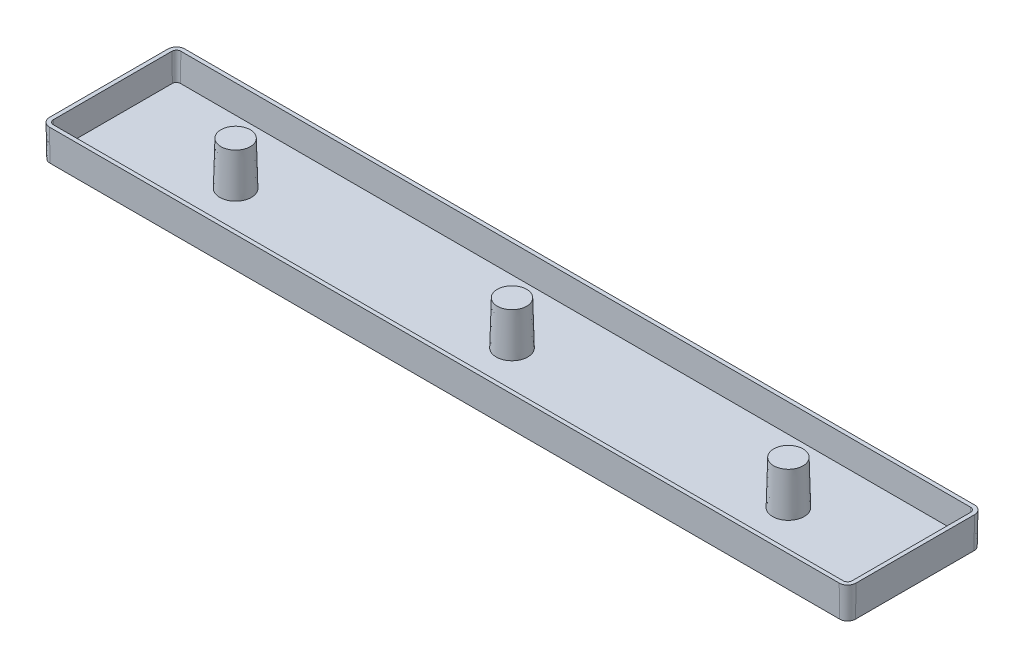
from build123d import *

# Parameters (mm, degrees)
BOSS_EXTRUDE1_DEPTH           = 4
BOSS_EXTRUDE1_DRAFT           = -1
SHELL1_T                      = -0.5
SKETCH2_R                     = 2
BOSS_EXTRUDE2_DEPTH           = 5.5
BOSS_EXTRUDE2_DRAFT           = 1.5
BOSS_EXTRUDE2_PROFILE_2_DEPTH = 5.5
BOSS_EXTRUDE2_PROFILE_2_DRAFT = 1.5
BOSS_EXTRUDE2_PROFILE_3_DEPTH = 5.5
BOSS_EXTRUDE2_PROFILE_3_DRAFT = 1.5


with BuildPart() as part:
    # Sketch1 → Boss-Extrude1 (with draft: the straight prism first)
    with BuildSketch(Plane(origin=(0, 0, 0), x_dir=(1, 0, 0), z_dir=(0, 1, 0))):
        with BuildLine():
            Line((-50, -8.5), (50, -8.5))
            ThreePointArc((50, -8.5), (50.707106781, -8.207106781), (51, -7.5))
            Line((51, -7.5), (51, 7.5))
            ThreePointArc((51, 7.5), (50.707106781, 8.207106781), (50, 8.5))
            Line((50, 8.5), (-50, 8.5))
            ThreePointArc((-50, 8.5), (-50.707106781, 8.207106781), (-51, 7.5))
            Line((-51, 7.5), (-51, -7.5))
            ThreePointArc((-51, -7.5), (-50.707106781, -8.207106781), (-50, -8.5))
        make_face()
    extrude(amount=BOSS_EXTRUDE1_DEPTH)
    # Boss-Extrude1: the draft: its side faces are tilted about the plane it starts from
    boss_extrude1_sides = [part.faces().sort_by_distance(p)[0] for p in [
        (0, 2, 8.5),
        (50.707106781, 2, 8.207106781),
        (51, 2, 0),
        (50.707106781, 2, -8.207106781),
        (0, 2, -8.5),
        (-50.707106781, 2, -8.207106781),
        (-51, 2, 0),
        (-50.707106781, 2, 8.207106781),
    ]]
    draft(boss_extrude1_sides, Plane(origin=(0, 0, 0), x_dir=(1, 0, 0), z_dir=(0, 1, 0)), BOSS_EXTRUDE1_DRAFT)

    # Shell1
    shell1_openings = [part.faces().sort_by_distance(p)[0] for p in [
        (0, 4, 0),
    ]]
    offset(amount=SHELL1_T, openings=shell1_openings, kind=Kind.INTERSECTION)


with BuildPart() as boss_extrude2_tool:
    # Sketch2 → Boss-Extrude2 (with draft: the straight prism first)
    with BuildSketch(Plane(origin=(0, 0.5, 0), x_dir=(1, 0, 0), z_dir=(0, 1, 0))):
        with Locations((35, 0)):
            Circle(SKETCH2_R)
    extrude(amount=BOSS_EXTRUDE2_DEPTH)
    # Boss-Extrude2: the draft: its side faces are tilted about the plane it starts from
    boss_extrude2_sides = [boss_extrude2_tool.faces().sort_by_distance(p)[0] for p in [
        (33, 3.25, 0),
    ]]
    draft(boss_extrude2_sides, Plane(origin=(0, 0.5, 0), x_dir=(1, 0, 0), z_dir=(0, 1, 0)), BOSS_EXTRUDE2_DRAFT)


with BuildPart() as part_1:
    add(part.part)

    # Boss-Extrude2: add boss_extrude2_tool
    add(boss_extrude2_tool.part)


with BuildPart() as boss_extrude2_profile_2_tool:
    # Sketch2 → Boss-Extrude2 profile 2 (with draft: the straight prism first)
    with BuildSketch(Plane(origin=(0, 0.5, 0), x_dir=(1, 0, 0), z_dir=(0, 1, 0))):
        Circle(SKETCH2_R)
    extrude(amount=BOSS_EXTRUDE2_PROFILE_2_DEPTH)
    # Boss-Extrude2 profile 2: the draft: its side faces are tilted about the plane it starts from
    boss_extrude2_profile_2_sides = [boss_extrude2_profile_2_tool.faces().sort_by_distance(p)[0] for p in [
        (-2, 3.25, 0),
    ]]
    draft(boss_extrude2_profile_2_sides, Plane(origin=(0, 0.5, 0), x_dir=(1, 0, 0), z_dir=(0, 1, 0)), BOSS_EXTRUDE2_PROFILE_2_DRAFT)


with BuildPart() as part_2:
    add(part_1.part)

    # Boss-Extrude2 profile 2: add boss_extrude2_profile_2_tool
    add(boss_extrude2_profile_2_tool.part)


with BuildPart() as boss_extrude2_profile_3_tool:
    # Sketch2 → Boss-Extrude2 profile 3 (with draft: the straight prism first)
    with BuildSketch(Plane(origin=(0, 0.5, 0), x_dir=(1, 0, 0), z_dir=(0, 1, 0))):
        with Locations((-35, 0)):
            Circle(SKETCH2_R)
    extrude(amount=BOSS_EXTRUDE2_PROFILE_3_DEPTH)
    # Boss-Extrude2 profile 3: the draft: its side faces are tilted about the plane it starts from
    boss_extrude2_profile_3_sides = [boss_extrude2_profile_3_tool.faces().sort_by_distance(p)[0] for p in [
        (-37, 3.25, 0),
    ]]
    draft(boss_extrude2_profile_3_sides, Plane(origin=(0, 0.5, 0), x_dir=(1, 0, 0), z_dir=(0, 1, 0)), BOSS_EXTRUDE2_PROFILE_3_DRAFT)


with BuildPart() as part_3:
    add(part_2.part)

    # Boss-Extrude2 profile 3: add boss_extrude2_profile_3_tool
    add(boss_extrude2_profile_3_tool.part)


solid = part_3.part
